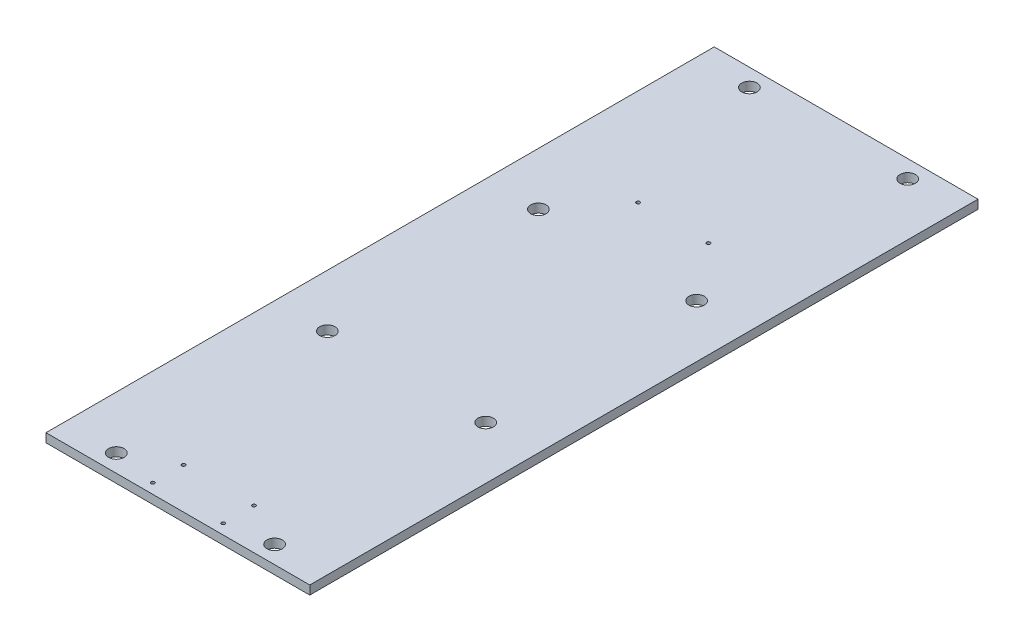
from build123d import *

# Parameters (mm, degrees)
SKETCH1_W                = 300
SKETCH1_H                = 760
BOSS_EXTRUDE1_DEPTH      = 10
F_4_0_4_DIAMETER_HOLE1_D = 4
M16_CLEARANCE_HOLE1_D    = 17.5


with BuildPart() as part:
    # Sketch1 → Boss-Extrude1 (new body)
    with BuildSketch(Plane.XZ.offset(-29.143326369)):
        with Locations((-180.300605602, 198.433128803)):
            Rectangle(SKETCH1_W, SKETCH1_H)
    extrude(amount=BOSS_EXTRUDE1_DEPTH)

    # Ø4.0 (4) Diameter Hole1 (through all)
    with Locations(Plane(origin=(-171.596169666, 38.143326369, 73.097017265), x_dir=(1, 0, 0), z_dir=(0, 1, 0))):
        with Locations((-48.704435936, -458.836111538), (-48.704435936, -493.836111538), (31.295564064, -493.836111538), (31.295564064, -458.836111538), (31.295564064, 58.078352635), (-48.704435936, 58.078352635)):
            Hole(F_4_0_4_DIAMETER_HOLE1_D / 2)

    # M16 Clearance Hole1 (through all)
    with Locations(Plane(origin=(0, 29.143326369, 0), x_dir=(1, 0, 0), z_dir=(0, 1, 0))):
        with Locations((-270.300605602, -78.433128803), (-90.300605602, -78.433128803), (-90.300605602, -318.433128803), (-270.300605602, -318.433128803), (-270.300605602, 161.566871197), (-90.300605602, 161.566871197), (-270.300605602, -558.433128803), (-90.300605602, -558.433128803)):
            Hole(M16_CLEARANCE_HOLE1_D / 2)


solid = part.part
